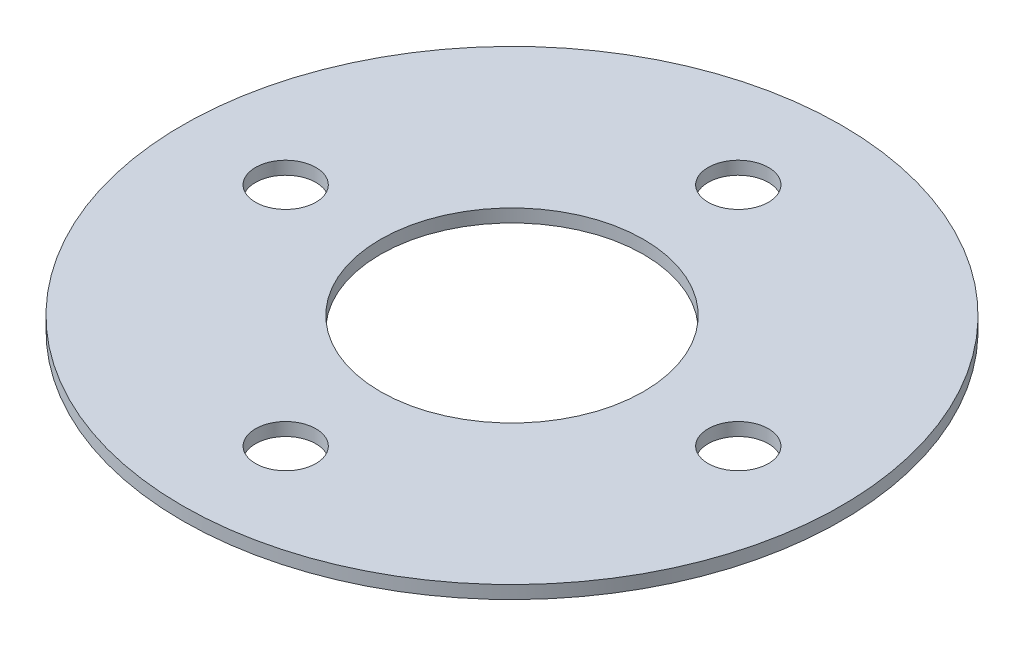
from build123d import *

# Parameters (mm, degrees)
SKETCH1_R           = 21.844
SKETCH1_R_2         = 2
BOSS_EXTRUDE1_DEPTH = 0.8636
SKETCH2_R           = 8.73125
CUT_EXTRUDE1_DEPTH  = 0.8636


with BuildPart() as part:
    # Sketch1 → Boss-Extrude1 (new body)
    with BuildSketch(Plane(origin=(0, 0, 0), x_dir=(1, 0, 0), z_dir=(0, 1, 0))):
        Circle(SKETCH1_R)
        with Locations((0, 15)):
            Circle(SKETCH1_R_2, mode=Mode.SUBTRACT)
        with Locations((15, 0)):
            Circle(SKETCH1_R_2, mode=Mode.SUBTRACT)
        with Locations((0, -15)):
            Circle(SKETCH1_R_2, mode=Mode.SUBTRACT)
        with Locations((-15, 0)):
            Circle(SKETCH1_R_2, mode=Mode.SUBTRACT)
    extrude(amount=BOSS_EXTRUDE1_DEPTH)

    # Sketch2 → Cut-Extrude1 (cut)
    with BuildSketch(Plane.XZ):
        Circle(SKETCH2_R)
    extrude(amount=-CUT_EXTRUDE1_DEPTH, mode=Mode.SUBTRACT)


solid = part.part
